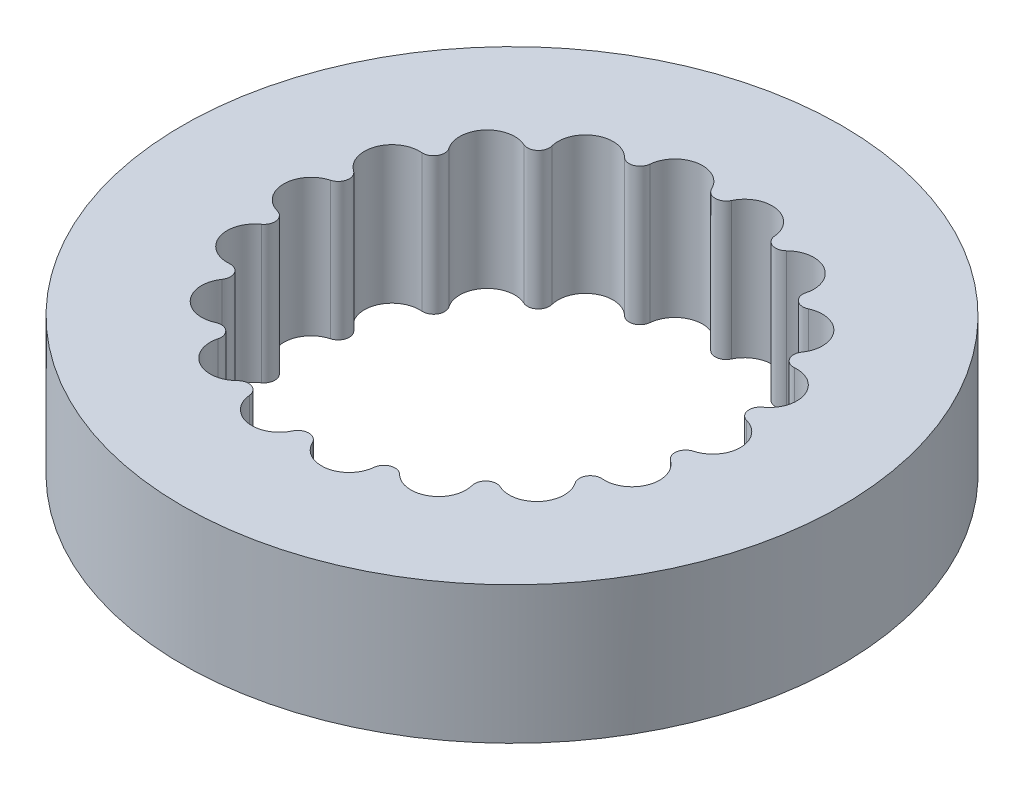
from build123d import *

# Parameters (mm, degrees)
SKETCH1_R           = 45
SKETCH1_R_2         = 2
SKETCH1_R_3         = 30
BOSS_EXTRUDE1_DEPTH = 5
BOSS_EXTRUDE2_START = 5
SKETCH2_R           = 45
SKETCH2_R_2         = 30
BOSS_EXTRUDE2_DEPTH = 5
SKETCH3_R           = 60
BOSS_EXTRUDE3_DEPTH = 20
CUT_EXTRUDE1_REACH  = 88.168
BOSS_EXTRUDE4_START = 5
SKETCH5_R           = 60
SKETCH5_R_2         = 45
BOSS_EXTRUDE4_DEPTH = 5


with BuildPart() as part:
    # Sketch1 → Boss-Extrude1 (new body)
    with BuildSketch(Plane(origin=(0, 0, 0), x_dir=(1, 0, 0), z_dir=(0, 1, 0))):
        Circle(SKETCH1_R)
        with Locations((0, 39)):
            Circle(SKETCH1_R_2, mode=Mode.SUBTRACT)
        with Locations((13.33878559, 36.648012211)):
            Circle(SKETCH1_R_2, mode=Mode.SUBTRACT)
        with Locations((25.068716778, 29.875733282)):
            Circle(SKETCH1_R_2, mode=Mode.SUBTRACT)
        with Locations((33.774990748, 19.5)):
            Circle(SKETCH1_R_2, mode=Mode.SUBTRACT)
        with Locations((38.407502367, 6.772278929)):
            Circle(SKETCH1_R_2, mode=Mode.SUBTRACT)
        with Locations((38.407502367, -6.772278929)):
            Circle(SKETCH1_R_2, mode=Mode.SUBTRACT)
        with Locations((33.774990748, -19.5)):
            Circle(SKETCH1_R_2, mode=Mode.SUBTRACT)
        with Locations((25.068716778, -29.875733282)):
            Circle(SKETCH1_R_2, mode=Mode.SUBTRACT)
        with Locations((13.33878559, -36.648012211)):
            Circle(SKETCH1_R_2, mode=Mode.SUBTRACT)
        with Locations((0, -39)):
            Circle(SKETCH1_R_2, mode=Mode.SUBTRACT)
        with Locations((-13.33878559, -36.648012211)):
            Circle(SKETCH1_R_2, mode=Mode.SUBTRACT)
        with Locations((-25.068716778, -29.875733282)):
            Circle(SKETCH1_R_2, mode=Mode.SUBTRACT)
        with Locations((-33.774990748, -19.5)):
            Circle(SKETCH1_R_2, mode=Mode.SUBTRACT)
        with Locations((-38.407502367, -6.772278929)):
            Circle(SKETCH1_R_2, mode=Mode.SUBTRACT)
        with Locations((-38.407502367, 6.772278929)):
            Circle(SKETCH1_R_2, mode=Mode.SUBTRACT)
        with Locations((-33.774990748, 19.5)):
            Circle(SKETCH1_R_2, mode=Mode.SUBTRACT)
        with Locations((-25.068716778, 29.875733282)):
            Circle(SKETCH1_R_2, mode=Mode.SUBTRACT)
        with Locations((-13.33878559, 36.648012211)):
            Circle(SKETCH1_R_2, mode=Mode.SUBTRACT)
        Circle(SKETCH1_R_3, mode=Mode.SUBTRACT)
    extrude(amount=BOSS_EXTRUDE1_DEPTH)

    # Sketch2 → Boss-Extrude2 (add)
    with BuildSketch(Plane.XZ.offset(BOSS_EXTRUDE2_START)):
        Circle(SKETCH2_R)
        Circle(SKETCH2_R_2, mode=Mode.SUBTRACT)
    extrude(amount=-BOSS_EXTRUDE2_DEPTH)

    # Sketch3 → Boss-Extrude3 (add)
    with BuildSketch(Plane(origin=(0, 0, 0), x_dir=(1, 0, 0), z_dir=(0, 1, 0))):
        Circle(SKETCH3_R)
        with BuildLine():
            ThreePointArc((-33.939016056, 17.506737424), (-32.04293994, 18.5), (-32.130787374, 20.638681372))
            ThreePointArc((-32.130787374, 20.638681372), (-31.849324915, 26.724756789), (-25.904586102, 28.058779107))
            ThreePointArc((-25.904586102, 28.058779107), (-23.783141558, 28.343644395), (-23.134219035, 30.383393091))
            ThreePointArc((-23.134219035, 30.383393091), (-20.788170452, 36.006167419), (-14.745680753, 35.226517926))
            ThreePointArc((-14.745680753, 35.226517926), (-12.654745303, 34.768626969), (-11.347322455, 36.463419192))
            ThreePointArc((-11.347322455, 36.463419192), (-7.219655832, 40.944702864), (-1.808228682, 38.145418796))
            ThreePointArc((-1.808228682, 38.145418796), (0, 37), (1.808228682, 38.145418796))
            ThreePointArc((1.808228682, 38.145418796), (7.219655832, 40.944702864), (11.347322455, 36.463419192))
            ThreePointArc((11.347322455, 36.463419192), (12.654745303, 34.768626969), (14.745680753, 35.226517926))
            ThreePointArc((14.745680753, 35.226517926), (20.788170452, 36.006167419), (23.134219035, 30.383393091))
            ThreePointArc((23.134219035, 30.383393091), (23.783141558, 28.343644395), (25.904586102, 28.058779107))
            ThreePointArc((25.904586102, 28.058779107), (31.849324915, 26.724756789), (32.130787374, 20.638681372))
            ThreePointArc((32.130787374, 20.638681372), (32.04293994, 18.5), (33.939016056, 17.506737424))
            ThreePointArc((33.939016056, 17.506737424), (39.068980747, 14.219946075), (37.251908557, 8.404640085))
            ThreePointArc((37.251908557, 8.404640085), (36.437886861, 6.424982574), (37.879899788, 4.843124835))
            ThreePointArc((37.879899788, 4.843124835), (41.576340904, 0), (37.879899788, -4.843124835))
            ThreePointArc((37.879899788, -4.843124835), (36.437886861, -6.424982574), (37.251908557, -8.404640085))
            ThreePointArc((37.251908557, -8.404640085), (39.068980747, -14.219946075), (33.939016056, -17.506737424))
            ThreePointArc((33.939016056, -17.506737424), (32.04293994, -18.5), (32.130787374, -20.638681372))
            ThreePointArc((32.130787374, -20.638681372), (31.849324915, -26.724756789), (25.904586102, -28.058779107))
            ThreePointArc((25.904586102, -28.058779107), (23.783141558, -28.343644395), (23.134219035, -30.383393091))
            ThreePointArc((23.134219035, -30.383393091), (20.788170452, -36.006167419), (14.745680753, -35.226517926))
            ThreePointArc((14.745680753, -35.226517926), (12.654745303, -34.768626969), (11.347322455, -36.463419192))
            ThreePointArc((11.347322455, -36.463419192), (7.219655832, -40.944702864), (1.808228682, -38.145418796))
            ThreePointArc((1.808228682, -38.145418796), (0, -37), (-1.808228682, -38.145418796))
            ThreePointArc((-1.808228682, -38.145418796), (-7.219655832, -40.944702864), (-11.347322455, -36.463419192))
            ThreePointArc((-11.347322455, -36.463419192), (-12.654745303, -34.768626969), (-14.745680753, -35.226517926))
            ThreePointArc((-14.745680753, -35.226517926), (-20.788170452, -36.006167419), (-23.134219035, -30.383393091))
            ThreePointArc((-23.134219035, -30.383393091), (-23.783141558, -28.343644395), (-25.904586102, -28.058779107))
            ThreePointArc((-25.904586102, -28.058779107), (-31.849324915, -26.724756789), (-32.130787374, -20.638681372))
            ThreePointArc((-32.130787374, -20.638681372), (-32.04293994, -18.5), (-33.939016056, -17.506737424))
            ThreePointArc((-33.939016056, -17.506737424), (-39.068980747, -14.219946075), (-37.251908557, -8.404640085))
            ThreePointArc((-37.251908557, -8.404640085), (-36.437886861, -6.424982574), (-37.879899788, -4.843124835))
            ThreePointArc((-37.879899788, -4.843124835), (-41.576340904, 0), (-37.879899788, 4.843124835))
            ThreePointArc((-37.879899788, 4.843124835), (-36.437886861, 6.424982574), (-37.251908557, 8.404640085))
            ThreePointArc((-37.251908557, 8.404640085), (-39.068980747, 14.219946075), (-33.939016056, 17.506737424))
        make_face(mode=Mode.SUBTRACT)
    extrude(amount=BOSS_EXTRUDE3_DEPTH)

    # Sketch4 → Cut-Extrude1 (cut, up to next)
    with BuildSketch(Plane(origin=(0, 5, 0), x_dir=(1, 0, 0), z_dir=(0, 1, 0)), mode=Mode.PRIVATE) as cut_extrude1_sk1:
        with BuildLine():
            ThreePointArc((-1.808228682, 38.145418796), (-7.219655832, 40.944702864), (-11.347322455, 36.463419192))
            ThreePointArc((-11.347322455, 36.463419192), (-12.654745303, 34.768626969), (-14.745680753, 35.226517926))
            ThreePointArc((-14.745680753, 35.226517926), (-20.788170452, 36.006167419), (-23.134219035, 30.383393091))
            ThreePointArc((-23.134219035, 30.383393091), (-23.783141558, 28.343644395), (-25.904586102, 28.058779107))
            ThreePointArc((-25.904586102, 28.058779107), (-31.849324915, 26.724756789), (-32.130787374, 20.638681372))
            ThreePointArc((-32.130787374, 20.638681372), (-32.04293994, 18.5), (-33.939016056, 17.506737424))
            ThreePointArc((-33.939016056, 17.506737424), (-39.068980747, 14.219946075), (-37.251908557, 8.404640085))
            ThreePointArc((-37.251908557, 8.404640085), (-36.437886861, 6.424982574), (-37.879899788, 4.843124835))
            ThreePointArc((-37.879899788, 4.843124835), (-41.576340904, 0), (-37.879899788, -4.843124835))
            ThreePointArc((-37.879899788, -4.843124835), (-36.437886861, -6.424982574), (-37.251908557, -8.404640085))
            ThreePointArc((-37.251908557, -8.404640085), (-39.068980747, -14.219946075), (-33.939016056, -17.506737424))
            ThreePointArc((-33.939016056, -17.506737424), (-32.04293994, -18.5), (-32.130787374, -20.638681372))
            ThreePointArc((-32.130787374, -20.638681372), (-31.849324915, -26.724756789), (-25.904586102, -28.058779107))
            ThreePointArc((-25.904586102, -28.058779107), (-23.783141558, -28.343644395), (-23.134219035, -30.383393091))
            ThreePointArc((-23.134219035, -30.383393091), (-20.788170452, -36.006167419), (-14.745680753, -35.226517926))
            ThreePointArc((-14.745680753, -35.226517926), (-12.654745303, -34.768626969), (-11.347322455, -36.463419192))
            ThreePointArc((-11.347322455, -36.463419192), (-7.219655832, -40.944702864), (-1.808228682, -38.145418796))
            ThreePointArc((-1.808228682, -38.145418796), (0, -37), (1.808228682, -38.145418796))
            ThreePointArc((1.808228682, -38.145418796), (7.219655832, -40.944702864), (11.347322455, -36.463419192))
            ThreePointArc((11.347322455, -36.463419192), (12.654745303, -34.768626969), (14.745680753, -35.226517926))
            ThreePointArc((14.745680753, -35.226517926), (20.788170452, -36.006167419), (23.134219035, -30.383393091))
            ThreePointArc((23.134219035, -30.383393091), (23.783141558, -28.343644395), (25.904586102, -28.058779107))
            ThreePointArc((25.904586102, -28.058779107), (31.849324915, -26.724756789), (32.130787374, -20.638681372))
            ThreePointArc((32.130787374, -20.638681372), (32.04293994, -18.5), (33.939016056, -17.506737424))
            ThreePointArc((33.939016056, -17.506737424), (39.068980747, -14.219946075), (37.251908557, -8.404640085))
            ThreePointArc((37.251908557, -8.404640085), (36.437886861, -6.424982574), (37.879899788, -4.843124835))
            ThreePointArc((37.879899788, -4.843124835), (41.576340904, 0), (37.879899788, 4.843124835))
            ThreePointArc((37.879899788, 4.843124835), (36.437886861, 6.424982574), (37.251908557, 8.404640085))
            ThreePointArc((37.251908557, 8.404640085), (39.068980747, 14.219946075), (33.939016056, 17.506737424))
            ThreePointArc((33.939016056, 17.506737424), (32.04293994, 18.5), (32.130787374, 20.638681372))
            ThreePointArc((32.130787374, 20.638681372), (31.849324915, 26.724756789), (25.904586102, 28.058779107))
            ThreePointArc((25.904586102, 28.058779107), (23.783141558, 28.343644395), (23.134219035, 30.383393091))
            ThreePointArc((23.134219035, 30.383393091), (20.788170452, 36.006167419), (14.745680753, 35.226517926))
            ThreePointArc((14.745680753, 35.226517926), (12.654745303, 34.768626969), (11.347322455, 36.463419192))
            ThreePointArc((11.347322455, 36.463419192), (7.219655832, 40.944702864), (1.808228682, 38.145418796))
            ThreePointArc((1.808228682, 38.145418796), (0, 37), (-1.808228682, 38.145418796))
        make_face()
    cut_extrude1_tool1 = extrude(cut_extrude1_sk1.sketch, amount=-CUT_EXTRUDE1_REACH, mode=Mode.PRIVATE) & part.part
    add(cut_extrude1_tool1.solids().sort_by_distance((0, 5, 0))[0], mode=Mode.SUBTRACT)

    # Sketch5 → Boss-Extrude4 (add)
    with BuildSketch(Plane.XZ.offset(BOSS_EXTRUDE4_START)):
        Circle(SKETCH5_R)
        Circle(SKETCH5_R_2, mode=Mode.SUBTRACT)
    extrude(amount=-BOSS_EXTRUDE4_DEPTH)


solid = part.part
